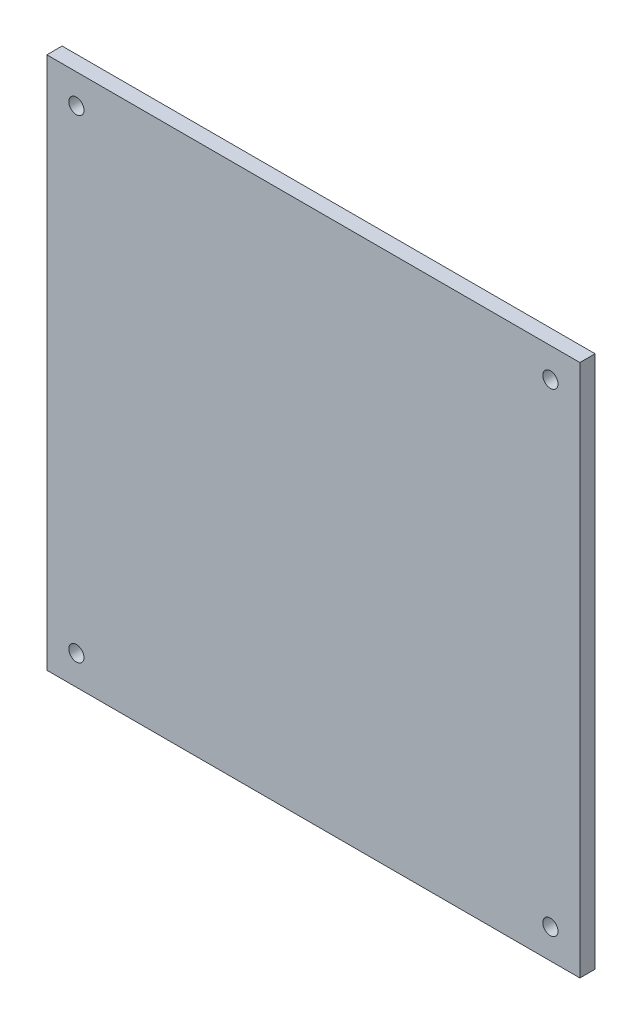
from build123d import *

# Parameters (mm, degrees)
SKETCH2_W          = 140
SKETCH2_H          = 140
SKETCH2_R          = 2
BASE_FLANGE2_DEPTH = 4


# Sheet-metal steps are written as plain solids
with BuildPart() as part:
    # Sketch2 → Base-Flange2 (new body)
    with BuildSketch(Plane.XY):
        with Locations((135.866052122, 31.228344263)):
            Rectangle(SKETCH2_W, SKETCH2_H)
        with Locations((73.616052122, 93.478344263)):
            Circle(SKETCH2_R, mode=Mode.SUBTRACT)
        with Locations((198.116052122, 93.478344263)):
            Circle(SKETCH2_R, mode=Mode.SUBTRACT)
        with Locations((198.116052122, -31.021655737)):
            Circle(SKETCH2_R, mode=Mode.SUBTRACT)
        with Locations((73.616052122, -31.021655737)):
            Circle(SKETCH2_R, mode=Mode.SUBTRACT)
    extrude(amount=-BASE_FLANGE2_DEPTH)


solid = part.part
